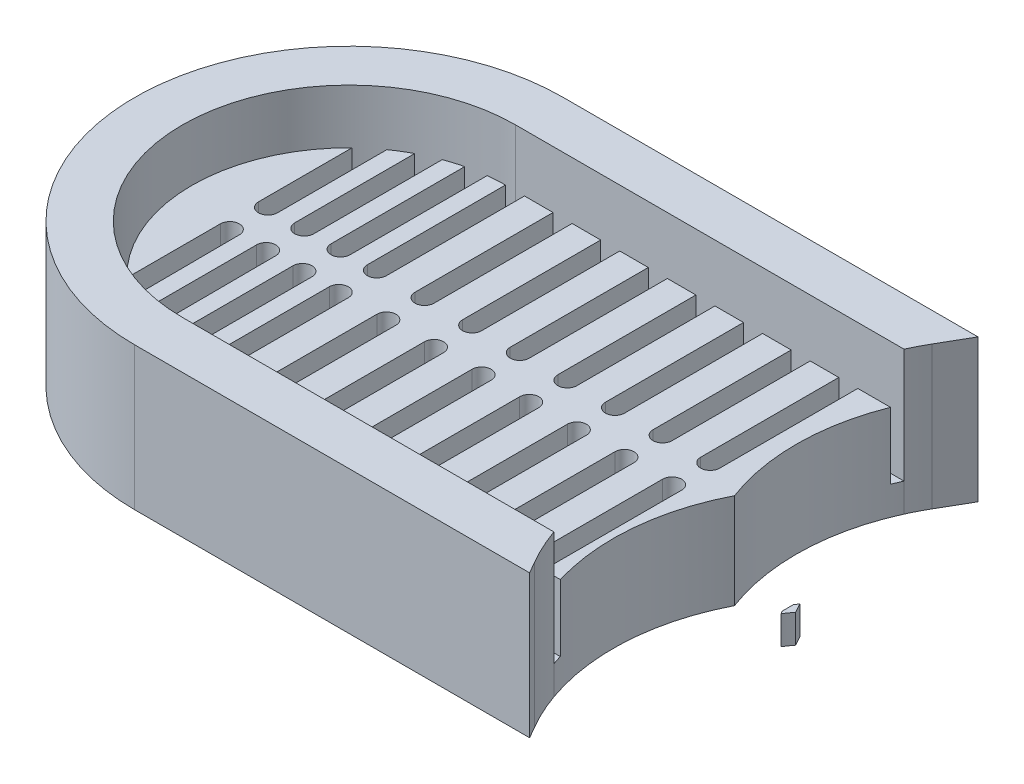
from build123d import *

# Parameters (mm, degrees)
BOSS_EXTRUDE1_DEPTH     = 10
BOSS_EXTRUDE2_DEPTH     = 15
BOSS_EXTRUDE3_OUTLINE_R = 0.460619733
BOSS_EXTRUDE3_DEPTH     = 3


# Read off the part's stored shape, not the designer's step: Boss-Extrude3
with BuildPart() as part:
    # Sketch1 → Boss-Extrude1 (new body)
    with BuildSketch(Plane(origin=(0, 0, 0), x_dir=(1, 0, 0), z_dir=(0, 1, 0))):
        with BuildLine():
            Line((14.43067924, -16.5), (16.190459123, -16.5))
            ThreePointArc((16.190459123, -16.5), (15.321234979, -7.965400111), (17.709566163, 0.274188473))
            ThreePointArc((17.709566163, 0.274188473), (16.271442646, 8.401181134), (17.860575095, 16.5))
            Line((17.860575095, 16.5), (14.43067924, 16.5))
            Line((14.43067924, 16.5), (14.43067924, 2))
            ThreePointArc((14.43067924, 2), (13.43067924, 1), (12.43067924, 2))
            Line((12.43067924, 2), (12.43067924, 16.5))
            Line((12.43067924, 16.5), (9.43067924, 16.5))
            Line((9.43067924, 16.5), (9.43067924, 2))
            ThreePointArc((9.43067924, 2), (8.43067924, 1), (7.43067924, 2))
            Line((7.43067924, 2), (7.43067924, 16.5))
            Line((7.43067924, 16.5), (4.43067924, 16.5))
            Line((4.43067924, 16.5), (4.43067924, 2))
            ThreePointArc((4.43067924, 2), (3.43067924, 1), (2.43067924, 2))
            Line((2.43067924, 2), (2.43067924, 16.5))
            Line((2.43067924, 16.5), (-0.56932076, 16.5))
            Line((-0.56932076, 16.5), (-0.56932076, 2))
            ThreePointArc((-0.56932076, 2), (-1.56932076, 1), (-2.56932076, 2))
            Line((-2.56932076, 2), (-2.56932076, 16.5))
            Line((-2.56932076, 16.5), (-5.56932076, 16.5))
            Line((-5.56932076, 16.5), (-5.56932076, 2))
            ThreePointArc((-5.56932076, 2), (-6.56932076, 1), (-7.56932076, 2))
            Line((-7.56932076, 2), (-7.56932076, 16.5))
            Line((-7.56932076, 16.5), (-10.56932076, 16.5))
            Line((-10.56932076, 16.5), (-10.56932076, 2))
            ThreePointArc((-10.56932076, 2), (-11.56932076, 1), (-12.56932076, 2))
            Line((-12.56932076, 2), (-12.56932076, 16.5))
            Line((-12.56932076, 16.5), (-15.56932076, 16.5))
            Line((-15.56932076, 16.5), (-15.56932076, 2))
            ThreePointArc((-15.56932076, 2), (-16.56932076, 1), (-17.56932076, 2))
            Line((-17.56932076, 2), (-17.56932076, 16.5))
            Line((-17.56932076, 16.5), (-20.56932076, 16.5))
            Line((-20.56932076, 16.5), (-20.56932076, 2))
            ThreePointArc((-20.56932076, 2), (-21.56932076, 1), (-22.56932076, 2))
            Line((-22.56932076, 2), (-22.56932076, 16.499854382))
            ThreePointArc((-22.56932076, 16.499854382), (-23.47726298, 16.47103388), (-24.382243117, 16.392289677))
            Line((-24.382243117, 16.392289677), (-24.382243117, 2))
            ThreePointArc((-24.382243117, 2), (-25.382243117, 1), (-26.382243117, 2))
            Line((-26.382243117, 2), (-26.382243117, 16.036776122))
            ThreePointArc((-26.382243117, 16.036776122), (-27.29661727, 15.787414695), (-28.195165473, 15.485964298))
            Line((-28.195165473, 15.485964298), (-28.195165473, 2))
            ThreePointArc((-28.195165473, 2), (-29.195165473, 1), (-30.195165473, 2))
            Line((-30.195165473, 2), (-30.195165473, 14.595698967))
            ThreePointArc((-30.195165473, 14.595698967), (-31.119534364, 14.069599402), (-32.008087829, 13.485038592))
            Line((-32.008087829, 13.485038592), (-32.008087829, 2))
            ThreePointArc((-32.008087829, 2), (-33.008087829, 1), (-34.008087829, 2))
            Line((-34.008087829, 2), (-34.008087829, 11.824293405))
            ThreePointArc((-34.008087829, 11.824293405), (-39, 0), (-34.008087829, -11.824293405))
            Line((-34.008087829, -11.824293405), (-34.008087829, -2))
            ThreePointArc((-34.008087829, -2), (-33.008087829, -1), (-32.008087829, -2))
            Line((-32.008087829, -2), (-31.945587829, -13.528890219))
            ThreePointArc((-31.945587829, -13.528890219), (-31.087308184, -14.089291613), (-30.195887564, -14.595318243))
            Line((-30.195887564, -14.595318243), (-30.195165473, -2))
            ThreePointArc((-30.195165473, -2), (-29.195165473, -1), (-28.195165473, -2))
            Line((-28.195165473, -2), (-28.133387564, -15.508544244))
            ThreePointArc((-28.133387564, -15.508544244), (-27.265851801, -15.796729301), (-26.383687299, -16.03642644))
            Line((-26.383687299, -16.03642644), (-26.382243117, -2))
            ThreePointArc((-26.382243117, -2), (-25.382243117, -1), (-24.382243117, -2))
            Line((-24.382243117, -2), (-24.382243117, -16.392289677))
            ThreePointArc((-24.382243117, -16.392289677), (-23.47726298, -16.47103388), (-22.56932076, -16.499854382))
            Line((-22.56932076, -16.499854382), (-22.56932076, -2))
            ThreePointArc((-22.56932076, -2), (-21.56932076, -1), (-20.56932076, -2))
            Line((-20.56932076, -2), (-20.56932076, -16.5))
            Line((-20.56932076, -16.5), (-17.56932076, -16.5))
            Line((-17.56932076, -16.5), (-17.56932076, -2))
            ThreePointArc((-17.56932076, -2), (-16.56932076, -1), (-15.56932076, -2))
            Line((-15.56932076, -2), (-15.56932076, -16.5))
            Line((-15.56932076, -16.5), (-12.56932076, -16.5))
            Line((-12.56932076, -16.5), (-12.56932076, -2))
            ThreePointArc((-12.56932076, -2), (-11.56932076, -1), (-10.56932076, -2))
            Line((-10.56932076, -2), (-10.56932076, -16.5))
            Line((-10.56932076, -16.5), (-7.56932076, -16.5))
            Line((-7.56932076, -16.5), (-7.56932076, -2))
            ThreePointArc((-7.56932076, -2), (-6.56932076, -1), (-5.56932076, -2))
            Line((-5.56932076, -2), (-5.56932076, -16.5))
            Line((-5.56932076, -16.5), (-2.56932076, -16.5))
            Line((-2.56932076, -16.5), (-2.56932076, -2))
            ThreePointArc((-2.56932076, -2), (-1.56932076, -1), (-0.56932076, -2))
            Line((-0.56932076, -2), (-0.56932076, -16.5))
            Line((-0.56932076, -16.5), (2.43067924, -16.5))
            Line((2.43067924, -16.5), (2.43067924, -2))
            ThreePointArc((2.43067924, -2), (3.43067924, -1), (4.43067924, -2))
            Line((4.43067924, -2), (4.43067924, -16.5))
            Line((4.43067924, -16.5), (7.43067924, -16.5))
            Line((7.43067924, -16.5), (7.43067924, -2))
            ThreePointArc((7.43067924, -2), (8.43067924, -1), (9.43067924, -2))
            Line((9.43067924, -2), (9.43067924, -16.5))
            Line((9.43067924, -16.5), (12.43067924, -16.5))
            Line((12.43067924, -16.5), (12.43067924, -2))
            ThreePointArc((12.43067924, -2), (13.43067924, -1), (14.43067924, -2))
            Line((14.43067924, -2), (14.43067924, -16.5))
        make_face()
    extrude(amount=BOSS_EXTRUDE1_DEPTH)

    # Boss-Extrude3 outline → Boss-Extrude3 (add)
    # profile 1 of 2: a face of its own
    with BuildSketch(Plane(origin=(0, 0, 0), x_dir=(1, 0, 0), z_dir=(0, 1, 0))):
        with BuildLine():
            ThreePointArc((23.707620362, -0.716668129), (23.796864688, -0.865870258), (23.887586858, -1.014178427))
            ThreePointArc((23.887586858, -1.014178427), (24.193405903, -0.559528413), (24.514152319, -0.115283368))
            ThreePointArc((24.514152319, -0.115283368), (24.24618875, 0.362657475), (23.99424227, 0.84923213))
            ThreePointArc((23.99424227, 0.84923213), (23.849676568, 0.663568045), (23.707620362, 0.475976923))
            Line((23.707620362, 0.475976923), (23.707620362, -0.716668129))
        make_face()
    # profile 2 of 2: a face of its own
    with BuildSketch(Plane(origin=(0, 0, 0), x_dir=(1, 0, 0), z_dir=(0, 1, 0))):
        with BuildLine():
            Line((18.286152049, 17.5), (-22.5, 17.5))
            ThreePointArc((-22.5, 17.5), (-40, 0), (-22.5, -17.5))
            Line((-22.5, -17.5), (16.518187187, -17.5))
            ThreePointArc((16.518187187, -17.5), (16.348476058, -17.001916258), (16.190459122, -16.5))
            Line((16.190459122, -16.5), (14.43067924, -16.5))
            Line((14.43067924, -16.5), (14.43067924, -2))
            ThreePointArc((14.43067924, -2), (13.43067924, -1), (12.43067924, -2))
            Line((12.43067924, -2), (12.43067924, -16.5))
            Line((12.43067924, -16.5), (9.43067924, -16.5))
            Line((9.43067924, -16.5), (9.43067924, -2))
            ThreePointArc((9.43067924, -2), (8.43067924, -1), (7.43067924, -2))
            Line((7.43067924, -2), (7.43067924, -16.5))
            Line((7.43067924, -16.5), (4.43067924, -16.5))
            Line((4.43067924, -16.5), (4.43067924, -2))
            ThreePointArc((4.43067924, -2), (3.43067924, -1), (2.43067924, -2))
            Line((2.43067924, -2), (2.43067924, -16.5))
            Line((2.43067924, -16.5), (-0.56932076, -16.5))
            Line((-0.56932076, -16.5), (-0.56932076, -2))
            ThreePointArc((-0.56932076, -2), (-1.56932076, -1), (-2.56932076, -2))
            Line((-2.56932076, -2), (-2.56932076, -16.5))
            Line((-2.56932076, -16.5), (-5.56932076, -16.5))
            Line((-5.56932076, -16.5), (-5.56932076, -2))
            ThreePointArc((-5.56932076, -2), (-6.56932076, -1), (-7.56932076, -2))
            Line((-7.56932076, -2), (-7.56932076, -16.5))
            Line((-7.56932076, -16.5), (-10.56932076, -16.5))
            Line((-10.56932076, -16.5), (-10.56932076, -2))
            ThreePointArc((-10.56932076, -2), (-11.56932076, -1), (-12.56932076, -2))
            Line((-12.56932076, -2), (-12.56932076, -16.5))
            Line((-12.56932076, -16.5), (-15.56932076, -16.5))
            Line((-15.56932076, -16.5), (-15.56932076, -2))
            ThreePointArc((-15.56932076, -2), (-16.56932076, -1), (-17.56932076, -2))
            Line((-17.56932076, -2), (-17.56932076, -16.5))
            Line((-17.56932076, -16.5), (-20.56932076, -16.5))
            Line((-20.56932076, -16.5), (-20.56932076, -2))
            ThreePointArc((-20.56932076, -2), (-21.56932076, -1), (-22.56932076, -2))
            Line((-22.56932076, -2), (-22.56932076, -16.499854382))
            ThreePointArc((-22.56932076, -16.499854382), (-23.47726298, -16.47103388), (-24.382243117, -16.392289677))
            Line((-24.382243117, -16.392289677), (-24.382243117, -2))
            ThreePointArc((-24.382243117, -2), (-25.382243117, -1), (-26.382243117, -2))
            Line((-26.382243117, -2), (-26.383687299, -16.03642644))
            ThreePointArc((-26.383687299, -16.03642644), (-27.265851801, -15.796729301), (-28.133387564, -15.508544244))
            Line((-28.133387564, -15.508544244), (-28.195165473, -2))
            ThreePointArc((-28.195165473, -2), (-29.195165473, -1), (-30.195165473, -2))
            Line((-30.195165473, -2), (-30.195887564, -14.595318243))
            ThreePointArc((-30.195887564, -14.595318243), (-31.087308184, -14.089291613), (-31.945587829, -13.528890219))
            Line((-31.945587829, -13.528890219), (-32.008087829, -2))
            ThreePointArc((-32.008087829, -2), (-33.008087829, -1), (-34.008087829, -2))
            Line((-34.008087829, -2), (-34.008087829, -11.824293405))
            ThreePointArc((-34.008087829, -11.824293405), (-39, 0), (-34.008087829, 11.824293405))
            Line((-34.008087829, 11.824293405), (-34.008087829, 2))
            ThreePointArc((-34.008087829, 2), (-33.008087829, 1), (-32.008087829, 2))
            Line((-32.008087829, 2), (-32.008087829, 13.485038592))
            ThreePointArc((-32.008087829, 13.485038592), (-31.119534364, 14.069599402), (-30.195165473, 14.595698967))
            Line((-30.195165473, 14.595698967), (-30.195165473, 2))
            ThreePointArc((-30.195165473, 2), (-29.195165473, 1), (-28.195165473, 2))
            Line((-28.195165473, 2), (-28.195165473, 15.485964298))
            ThreePointArc((-28.195165473, 15.485964298), (-27.296617271, 15.787414695), (-26.382243117, 16.036776122))
            Line((-26.382243117, 16.036776122), (-26.382243117, 2))
            ThreePointArc((-26.382243117, 2), (-25.382243117, 1), (-24.382243117, 2))
            Line((-24.382243117, 2), (-24.382243117, 16.392289677))
            ThreePointArc((-24.382243117, 16.392289677), (-23.47726298, 16.47103388), (-22.56932076, 16.499854382))
            Line((-22.56932076, 16.499854382), (-22.56932076, 2))
            ThreePointArc((-22.56932076, 2), (-21.56932076, 1), (-20.56932076, 2))
            Line((-20.56932076, 2), (-20.56932076, 16.5))
            Line((-20.56932076, 16.5), (-17.56932076, 16.5))
            Line((-17.56932076, 16.5), (-17.56932076, 2))
            ThreePointArc((-17.56932076, 2), (-16.56932076, 1), (-15.56932076, 2))
            Line((-15.56932076, 2), (-15.56932076, 16.5))
            Line((-15.56932076, 16.5), (-12.56932076, 16.5))
            Line((-12.56932076, 16.5), (-12.56932076, 2))
            ThreePointArc((-12.56932076, 2), (-11.56932076, 1), (-10.56932076, 2))
            Line((-10.56932076, 2), (-10.56932076, 16.5))
            Line((-10.56932076, 16.5), (-7.56932076, 16.5))
            Line((-7.56932076, 16.5), (-7.56932076, 2))
            ThreePointArc((-7.56932076, 2), (-6.56932076, 1), (-5.56932076, 2))
            Line((-5.56932076, 2), (-5.56932076, 16.5))
            Line((-5.56932076, 16.5), (-2.56932076, 16.5))
            Line((-2.56932076, 16.5), (-2.56932076, 2))
            ThreePointArc((-2.56932076, 2), (-1.56932076, 1), (-0.56932076, 2))
            Line((-0.56932076, 2), (-0.56932076, 16.5))
            Line((-0.56932076, 16.5), (2.43067924, 16.5))
            Line((2.43067924, 16.5), (2.43067924, 2))
            ThreePointArc((2.43067924, 2), (3.43067924, 1), (4.43067924, 2))
            Line((4.43067924, 2), (4.43067924, 16.5))
            Line((4.43067924, 16.5), (7.43067924, 16.5))
            Line((7.43067924, 16.5), (7.43067924, 2))
            ThreePointArc((7.43067924, 2), (8.43067924, 1), (9.43067924, 2))
            Line((9.43067924, 2), (9.43067924, 16.5))
            Line((9.43067924, 16.5), (12.43067924, 16.5))
            Line((12.43067924, 16.5), (12.43067924, 2))
            ThreePointArc((12.43067924, 2), (13.43067924, 1), (14.43067924, 2))
            Line((14.43067924, 2), (14.43067924, 16.5))
            Line((14.43067924, 16.5), (17.860575095, 16.5))
            ThreePointArc((17.860575095, 16.5), (18.067324961, 17.002569894), (18.286152049, 17.5))
        make_face()
        with Locations((-33.008087829, -2)):
            Circle(BOSS_EXTRUDE3_OUTLINE_R, mode=Mode.SUBTRACT)
        with Locations((-29.308087829, -2)):
            Circle(BOSS_EXTRUDE3_OUTLINE_R, mode=Mode.SUBTRACT)
        with Locations((-25.608087829, -2)):
            Circle(BOSS_EXTRUDE3_OUTLINE_R, mode=Mode.SUBTRACT)
        with Locations((-21.908087829, -2)):
            Circle(BOSS_EXTRUDE3_OUTLINE_R, mode=Mode.SUBTRACT)
        with Locations((-16.56932076, -2)):
            Circle(BOSS_EXTRUDE3_OUTLINE_R, mode=Mode.SUBTRACT)
        with Locations((-11.56932076, -2)):
            Circle(BOSS_EXTRUDE3_OUTLINE_R, mode=Mode.SUBTRACT)
        with Locations((-6.56932076, -2)):
            Circle(BOSS_EXTRUDE3_OUTLINE_R, mode=Mode.SUBTRACT)
        with Locations((-1.56932076, -2)):
            Circle(BOSS_EXTRUDE3_OUTLINE_R, mode=Mode.SUBTRACT)
        with Locations((3.43067924, -2)):
            Circle(BOSS_EXTRUDE3_OUTLINE_R, mode=Mode.SUBTRACT)
        with Locations((8.43067924, -2)):
            Circle(BOSS_EXTRUDE3_OUTLINE_R, mode=Mode.SUBTRACT)
        with Locations((13.43067924, -2)):
            Circle(BOSS_EXTRUDE3_OUTLINE_R, mode=Mode.SUBTRACT)
        with Locations((-33.008087829, 2)):
            Circle(BOSS_EXTRUDE3_OUTLINE_R, mode=Mode.SUBTRACT)
        with Locations((-29.308087829, 2)):
            Circle(BOSS_EXTRUDE3_OUTLINE_R, mode=Mode.SUBTRACT)
        with Locations((-25.608087829, 2)):
            Circle(BOSS_EXTRUDE3_OUTLINE_R, mode=Mode.SUBTRACT)
        with Locations((-21.908087829, 2)):
            Circle(BOSS_EXTRUDE3_OUTLINE_R, mode=Mode.SUBTRACT)
        with Locations((-16.56932076, 2)):
            Circle(BOSS_EXTRUDE3_OUTLINE_R, mode=Mode.SUBTRACT)
        with Locations((-11.56932076, 2)):
            Circle(BOSS_EXTRUDE3_OUTLINE_R, mode=Mode.SUBTRACT)
        with Locations((-6.56932076, 2)):
            Circle(BOSS_EXTRUDE3_OUTLINE_R, mode=Mode.SUBTRACT)
        with Locations((-1.56932076, 2)):
            Circle(BOSS_EXTRUDE3_OUTLINE_R, mode=Mode.SUBTRACT)
        with Locations((3.43067924, 2)):
            Circle(BOSS_EXTRUDE3_OUTLINE_R, mode=Mode.SUBTRACT)
        with Locations((8.43067924, 2)):
            Circle(BOSS_EXTRUDE3_OUTLINE_R, mode=Mode.SUBTRACT)
        with Locations((13.43067924, 2)):
            Circle(BOSS_EXTRUDE3_OUTLINE_R, mode=Mode.SUBTRACT)
    extrude(amount=BOSS_EXTRUDE3_DEPTH)


with BuildPart() as body_2:
    # Sketch1<4> → Boss-Extrude2 (new body)
    with BuildSketch(Plane(origin=(0, 0, 0), x_dir=(1, 0, 0), z_dir=(0, 1, 0))):
        with BuildLine():
            ThreePointArc((18.243960123, -21.244744266), (17.295111664, -19.41198789), (16.518187187, -17.5))
            Line((16.518187187, -17.5), (-22.5, -17.5))
            ThreePointArc((-22.5, -17.5), (-22.534660448, -17.499965676), (-22.56932076, -17.499862703))
            ThreePointArc((-22.56932076, -17.499862703), (-23.477097705, -17.472700995), (-24.382243117, -17.398481567))
            ThreePointArc((-24.382243117, -17.398481567), (-40, 0), (-24.382243117, 17.398481567))
            ThreePointArc((-24.382243117, 17.398481567), (-23.477097705, 17.472700995), (-22.56932076, 17.499862703))
            ThreePointArc((-22.56932076, 17.499862703), (-22.534660448, 17.499965676), (-22.5, 17.5))
            Line((-22.5, 17.5), (18.286152049, 17.5))
            ThreePointArc((18.286152049, 17.5), (18.761954614, 18.483017537), (19.284896707, 19.441789214))
            Line((19.284896707, 19.441789214), (21.050555528, 22.5))
            Line((21.050555528, 22.5), (-22.5, 22.5))
            ThreePointArc((-22.5, 22.5), (-45, 0), (-22.5, -22.5))
            Line((-22.5, -22.5), (18.968682359, -22.5))
            Line((18.968682359, -22.5), (18.243960123, -21.244744266))
        make_face()
    extrude(amount=BOSS_EXTRUDE2_DEPTH)


solid = Compound([part.part, body_2.part])
